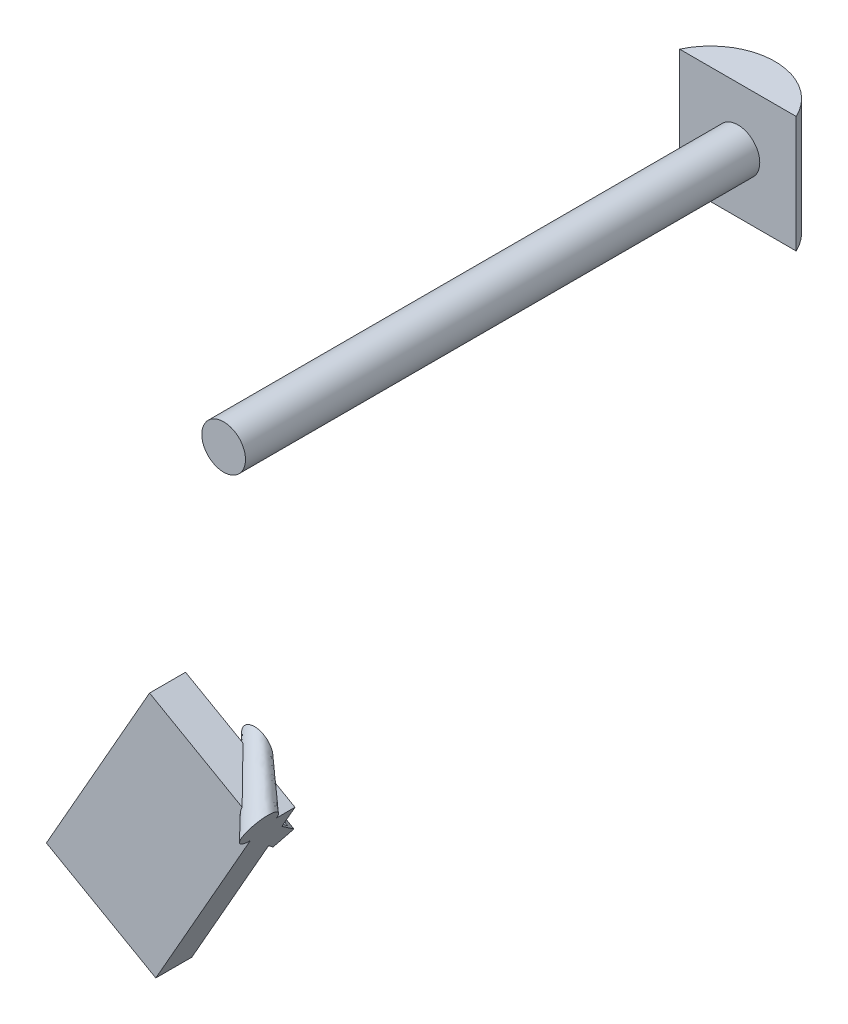
from build123d import *

# Parameters (mm, degrees)
SKETCH1_R           = 2.38125
BOSS_EXTRUDE1_DEPTH = 58.596630013
BOSS_EXTRUDE2_DEPTH = 6.35
BOSS_EXTRUDE4_DEPTH = 2.032
SKETCH9_W           = 3.923830529
SKETCH9_H           = 22.741437235
BOSS_EXTRUDE5_DEPTH = 13.716
SKETCH10_W          = 30.955715765
SKETCH10_H          = 16.793936396
CUT_EXTRUDE1_DEPTH  = 25.146


with BuildPart() as part:
    # Sketch1 → Boss-Extrude1 (new body)
    with BuildSketch(Plane.XY):
        Circle(SKETCH1_R)
    extrude(amount=BOSS_EXTRUDE1_DEPTH)

    # Sketch2 → Boss-Extrude2 (add, symmetric)
    with BuildSketch(Plane(origin=(0, 0, 0), x_dir=(1, 0, 0), z_dir=(0, 1, 0))):
        with BuildLine():
            Line((-6.35, -2.563701192), (0, -2.563701192))
            Line((0, -2.563701192), (6.35, -2.563701192))
            ThreePointArc((6.35, -2.563701192), (0, 1.474189404), (-6.35, -2.563701192))
        make_face()
    extrude(amount=BOSS_EXTRUDE2_DEPTH, both=True)


with BuildPart() as body_2:
    # Loft1: read off the stored shape, not the designer's step
    # Loft1: loft between two sections, ruled curve by curve
    loft1_from = [
        Edge.make_bspline([(24.635403527, -12.878615764, 80.537548375), (24.703010916, -12.759717555, 80.455728817), (24.77457053, -12.633868737, 80.346542629), (24.911732936, -12.392647108, 80.047422189), (24.977401408, -12.277158789, 79.856219839), (25.072825843, -12.109339936, 79.38415277), (25.101598912, -12.058737976, 79.101944057), (25.087030549, -12.08435873, 78.502649545), (25.042262607, -12.163090185, 78.187958466), (24.880490774, -12.447591356, 77.640856383), (24.76460641, -12.651392206, 77.412231552), (24.510487992, -13.098299348, 77.102844403), (24.373971523, -13.338384995, 77.020671771), (24.123246128, -13.779324972, 76.96752084), (24.008916688, -13.980391244, 76.994154883), (23.813775258, -14.323578092, 77.097193937), (23.732379916, -14.466724581, 77.173116318), (23.597165139, -14.704520999, 77.336755435), (23.525605524, -14.830369818, 77.445941623), (23.388443119, -15.071591446, 77.745062063), (23.322774646, -15.187079766, 77.936264413), (23.227350212, -15.354898618, 78.408331482), (23.198577142, -15.405500579, 78.690540195), (23.213145506, -15.379879824, 79.289834707), (23.257913447, -15.30114837, 79.604525786), (23.41968528, -15.016647199, 80.151627869), (23.535569644, -14.812846348, 80.3802527), (23.789688063, -14.365939206, 80.689639849), (23.926204532, -14.125853559, 80.771812481), (24.176929926, -13.684913583, 80.824963412), (24.291259366, -13.483847311, 80.798329369), (24.486400797, -13.140660463, 80.695290315), (24.567796138, -12.997513973, 80.619367934), (24.635403527, -12.878615764, 80.537548375)], [0, 0, 0, 0, 0.0625, 0.0625, 0.125, 0.125, 0.1875, 0.1875, 0.25, 0.25, 0.3125, 0.3125, 0.375, 0.375, 0.4375, 0.4375, 0.5, 0.5, 0.5625, 0.5625, 0.625, 0.625, 0.6875, 0.6875, 0.75, 0.75, 0.8125, 0.8125, 0.875, 0.875, 0.9375, 0.9375, 1, 1, 1, 1], 3),
    ]
    loft1_to = [
        Edge.make_bspline([(2.767629763, 0.049839418, 56.82236264), (2.714463118, -0.043662476, 56.704750196), (2.64725177, -0.161864184, 56.584786377), (2.474918122, -0.464939965, 56.372841519), (2.369168557, -0.65091718, 56.28098433), (2.12144239, -1.086582543, 56.186412949), (1.979011826, -1.337069056, 56.185916163), (1.691706982, -1.842339737, 56.334845804), (1.548278172, -2.094581822, 56.486619954), (1.315737433, -2.503541227, 56.916862609), (1.228234782, -2.657428378, 57.192353655), (1.129312793, -2.83139823, 57.758013891), (1.116866397, -2.853287171, 58.045061216), (1.141353454, -2.810222836, 58.552665546), (1.177154765, -2.747260609, 58.773939726), (1.266145812, -2.590755879, 59.140083551), (1.319218682, -2.497418903, 59.286206124), (1.425551973, -2.310415115, 59.521431011), (1.49276332, -2.192213406, 59.64139483), (1.665096968, -1.889137626, 59.853339688), (1.770846533, -1.70316041, 59.945196877), (2.0185727, -1.267495047, 60.039768258), (2.161003265, -1.017008534, 60.040265044), (2.448308108, -0.511737853, 59.891335404), (2.591736918, -0.259495768, 59.739561253), (2.824277658, 0.149463636, 59.309318598), (2.911780308, 0.303350787, 59.033827552), (3.010702298, 0.477320639, 58.468167316), (3.023148693, 0.49920958, 58.181119991), (2.998661636, 0.456145246, 57.673515661), (2.962860325, 0.393183019, 57.452241481), (2.873869279, 0.236678289, 57.086097656), (2.820796408, 0.143341312, 56.939975083), (2.767629763, 0.049839418, 56.82236264)], [0, 0, 0, 0, 0.0625, 0.0625, 0.125, 0.125, 0.1875, 0.1875, 0.25, 0.25, 0.3125, 0.3125, 0.375, 0.375, 0.4375, 0.4375, 0.5, 0.5, 0.5625, 0.5625, 0.625, 0.625, 0.6875, 0.6875, 0.75, 0.75, 0.8125, 0.8125, 0.875, 0.875, 0.9375, 0.9375, 1, 1, 1, 1], 3),
    ]
    loft1 = Solid(Shell([*[Face.make_surface_from_curves(loft1_from[k], loft1_to[k]) for k in range(1)], Face(Wire(loft1_from)), Face(Wire(loft1_to))]))
    add(loft1)

    # Sketch8 → Boss-Extrude4 (add)
    with BuildSketch(Plane(origin=(24.150088027, -13.732119277, 0), x_dir=(0, 0, -1), z_dir=(0.869294507164732, -0.49429450716473244, 0))):
        Polygon((-78.75825642, -2.050545662), (-73.982171856, -6.826630226), (-72.464389408, -5.308847777), (-76.921993148, -1.025272831), (-76.921993148, 0), (-78.896242126, 0), (-78.896242126, -2.050545662), align=None)
    extrude(amount=-BOSS_EXTRUDE4_DEPTH)

    # Sketch9 → Boss-Extrude5 (add)
    with BuildSketch(Plane(origin=(24.150088027, -13.732119277, 0), x_dir=(0, 0, -1), z_dir=(0.869294507164732, -0.49429450716473244, 0))):
        with Locations((-76.934326862, -11.370718618)):
            Rectangle(SKETCH9_W, SKETCH9_H)
    extrude(amount=-BOSS_EXTRUDE5_DEPTH)

    # Sketch10 → Cut-Extrude1 (cut)
    with BuildSketch(Plane(origin=(2.070007545, -1.177038795, 0), x_dir=(0, 0, -1), z_dir=(0.8692945071647321, -0.49429450716473244, 0))):
        with Locations((-58.515492189, 3.957209781)):
            Rectangle(SKETCH10_W, SKETCH10_H)
    extrude(amount=CUT_EXTRUDE1_DEPTH, mode=Mode.SUBTRACT)


solid = Compound([part.part, body_2.part])
